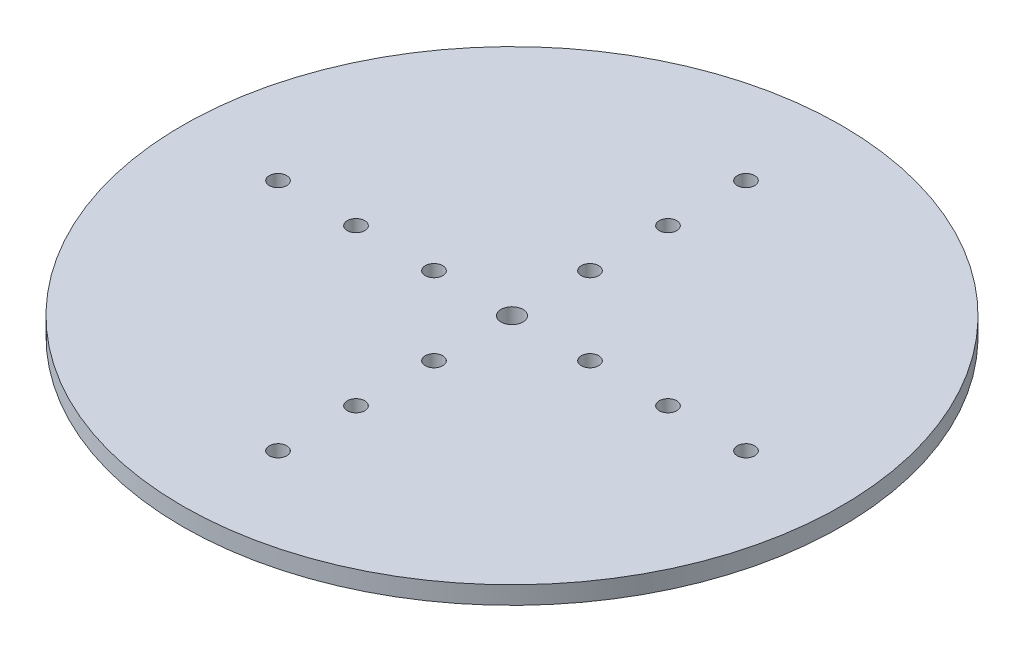
from build123d import *

# Parameters (mm, degrees)
CROQUIS1_R              = 120
SALIENTE_EXTRUIR1_DEPTH = 6.5
CROQUIS2_R              = 4
CORTAR_EXTRUIR1_DEPTH   = 6.5
CROQUIS3_R              = 3.175
CORTAR_EXTRUIR2_DEPTH   = 6.5


with BuildPart() as part:
    # Croquis1 → Saliente-Extruir1 (new body)
    with BuildSketch(Plane(origin=(0, 0, 0), x_dir=(1, 0, 0), z_dir=(0, 1, 0))):
        Circle(CROQUIS1_R)
    extrude(amount=SALIENTE_EXTRUIR1_DEPTH)

    # Croquis2 → Cortar-Extruir1 (cut)
    with BuildSketch(Plane(origin=(0, 6.5, 0), x_dir=(1, 0, 0), z_dir=(0, 1, 0))):
        Circle(CROQUIS2_R)
    extrude(amount=-CORTAR_EXTRUIR1_DEPTH, mode=Mode.SUBTRACT)

    # Croquis3 → Cortar-Extruir2 (cut)
    with BuildSketch(Plane(origin=(0, 0, 0), x_dir=(-1, 0, 0), z_dir=(0, -1, 0))):
        with Locations((-28.4, 0)):
            Circle(CROQUIS3_R)
        with Locations((-56.8, 0)):
            Circle(CROQUIS3_R)
        with Locations((-85.2, 0)):
            Circle(CROQUIS3_R)
        with Locations((85.2, 0)):
            Circle(CROQUIS3_R)
        with Locations((56.8, 0)):
            Circle(CROQUIS3_R)
        with Locations((28.4, 0)):
            Circle(CROQUIS3_R)
        with Locations((0, -28.4)):
            Circle(CROQUIS3_R)
        with Locations((0, -56.8)):
            Circle(CROQUIS3_R)
        with Locations((0, -85.2)):
            Circle(CROQUIS3_R)
        with Locations((0, 85.2)):
            Circle(CROQUIS3_R)
        with Locations((0, 56.8)):
            Circle(CROQUIS3_R)
        with Locations((0, 28.4)):
            Circle(CROQUIS3_R)
    extrude(amount=-CORTAR_EXTRUIR2_DEPTH, mode=Mode.SUBTRACT)


solid = part.part
